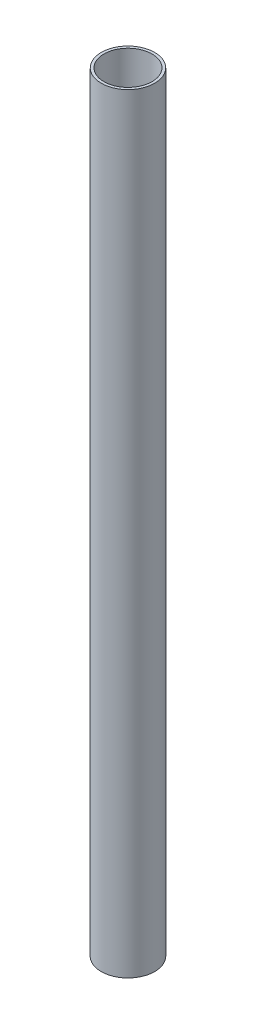
from build123d import *

# Parameters (mm, degrees)
SKETCH1_R           = 31.75
BOSS_EXTRUDE1_DEPTH = 914.4
SKETCH2_R           = 28.575
CUT_EXTRUDE1_DEPTH  = 916.501766792


with BuildPart() as part:
    # Sketch1 → Boss-Extrude1 (new body)
    with BuildSketch(Plane(origin=(0, 0, 0), x_dir=(1, 0, 0), z_dir=(0, 1, 0))):
        Circle(SKETCH1_R)
    extrude(amount=-BOSS_EXTRUDE1_DEPTH)

    # Sketch2 → Cut-Extrude1 (cut, through all)
    with BuildSketch(Plane(origin=(0, 0, 0), x_dir=(1, 0, 0), z_dir=(0, 1, 0))):
        Circle(SKETCH2_R)
    extrude(amount=-CUT_EXTRUDE1_DEPTH, mode=Mode.SUBTRACT)


solid = part.part
